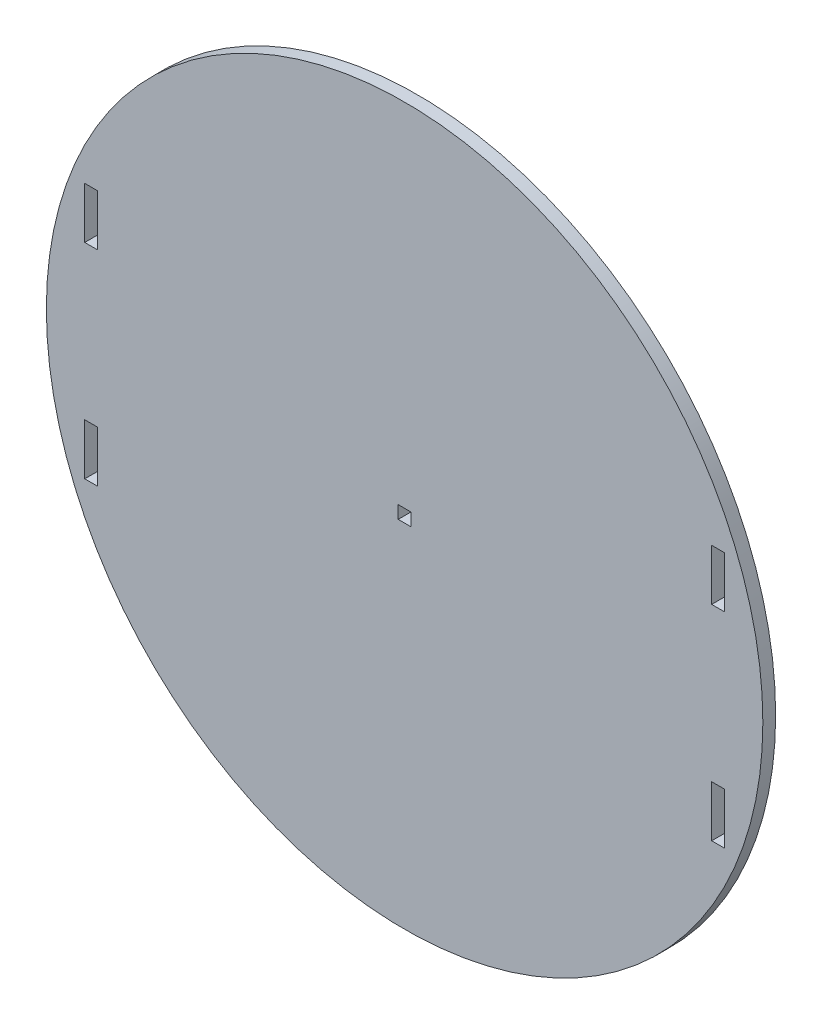
from build123d import *

# Parameters (mm, degrees)
SKETCH1_R           = 88.9
SKETCH1_W           = 3.175
SKETCH1_H           = 12.7
SKETCH1_H_2         = 3.175
BOSS_EXTRUDE1_DEPTH = 3.175


with BuildPart() as part:
    # Sketch1 → Boss-Extrude1 (new body)
    with BuildSketch(Plane.XY):
        Circle(SKETCH1_R)
        with Locations((77.7875, 25.38476)):
            Rectangle(SKETCH1_W, SKETCH1_H, mode=Mode.SUBTRACT)
        Rectangle(SKETCH1_W, SKETCH1_H_2, mode=Mode.SUBTRACT)
        with Locations((77.7875, -25.41524)):
            Rectangle(SKETCH1_W, SKETCH1_H, mode=Mode.SUBTRACT)
        with Locations((-77.7875, -25.41524)):
            Rectangle(SKETCH1_W, SKETCH1_H, mode=Mode.SUBTRACT)
        with Locations((-77.7875, 25.38476)):
            Rectangle(SKETCH1_W, SKETCH1_H, mode=Mode.SUBTRACT)
    extrude(amount=BOSS_EXTRUDE1_DEPTH)


solid = part.part
